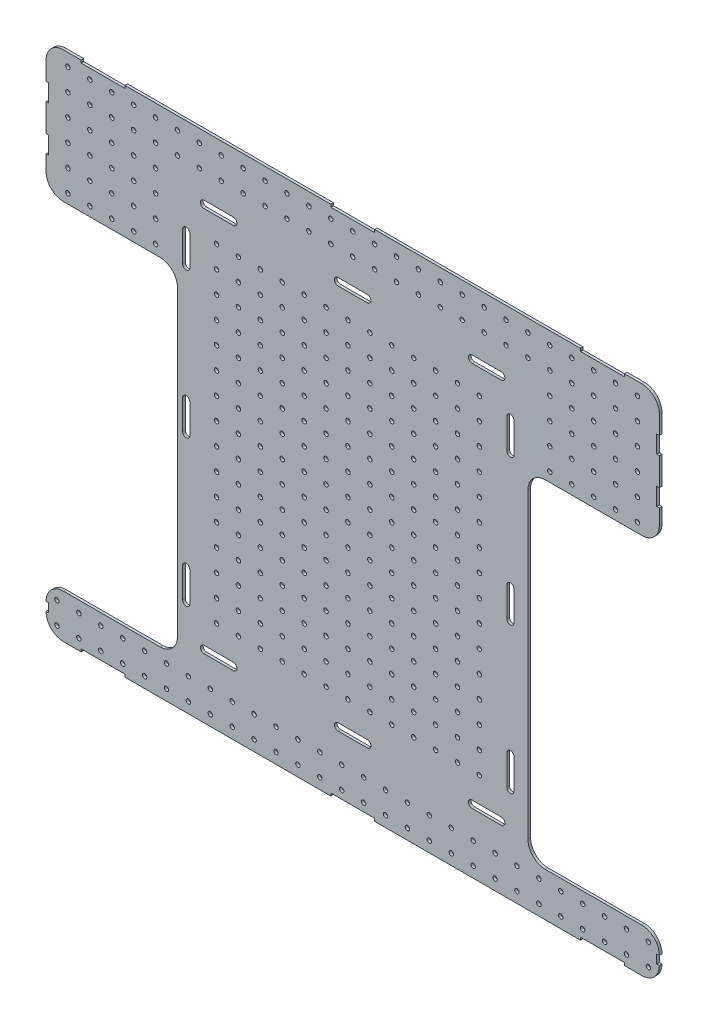
from build123d import *

# Parameters (mm, degrees)
SKETCH1_R           = 2
BOSS_EXTRUDE1_DEPTH = 3
CUT_EXTRUDE1_DEPTH  = 3
SKETCH3_W           = 50
SKETCH3_H           = 3
SKETCH3_W_2         = 3
SKETCH3_H_2         = 20
SKETCH3_H_3         = 10
CUT_EXTRUDE2_DEPTH  = 3
SKETCH4_W           = 321.794518566
SKETCH4_H           = 376.51592147
BOSS_EXTRUDE2_DEPTH = 3
SKETCH6_R           = 2.55
CUT_EXTRUDE4_DEPTH  = 3
SKETCH7_R           = 2.55
CUT_EXTRUDE5_DEPTH  = 3
SKETCH8_R           = 2.55
CUT_EXTRUDE6_DEPTH  = 3


with BuildPart() as part:
    # Sketch1 → Boss-Extrude1 (new body)
    with BuildSketch(Plane.XY):
        with BuildLine():
            ThreePointArc((-350, 162.5), (-344.142135624, 148.357864376), (-330, 142.5))
            Line((-330, 142.5), (-220, 142.5))
            ThreePointArc((-220, 142.5), (-205.857864376, 136.642135624), (-200, 122.5))
            Line((-200, 122.5), (-200, -222.5))
            ThreePointArc((-200, -222.5), (-205.857864376, -236.642135624), (-220, -242.5))
            Line((-220, -242.5), (-330, -242.5))
            ThreePointArc((-330, -242.5), (-344.142135624, -248.357864376), (-350, -262.5))
            Line((-350, -262.5), (-350, -272.5))
            ThreePointArc((-350, -272.5), (-344.142135624, -286.642135624), (-330, -292.5))
            Line((-330, -292.5), (330, -292.5))
            ThreePointArc((330, -292.5), (344.142135624, -286.642135624), (350, -272.5))
            Line((350, -272.5), (350, -262.5))
            ThreePointArc((350, -262.5), (344.142135624, -248.357864376), (330, -242.5))
            Line((330, -242.5), (220, -242.5))
            ThreePointArc((220, -242.5), (205.857864376, -236.642135624), (200, -222.5))
            Line((200, -222.5), (200, 122.5))
            ThreePointArc((200, 122.5), (205.857864376, 136.642135624), (220, 142.5))
            Line((220, 142.5), (330, 142.5))
            ThreePointArc((330, 142.5), (344.142135624, 148.357864376), (350, 162.5))
            Line((350, 162.5), (350, 272.5))
            ThreePointArc((350, 272.5), (344.142135624, 286.642135624), (330, 292.5))
            Line((330, 292.5), (-330, 292.5))
            ThreePointArc((-330, 292.5), (-344.142135624, 286.642135624), (-350, 272.5))
            Line((-350, 272.5), (-350, 162.5))
        make_face()
        with Locations((-155.454259852, -175.774310753)):
            Circle(SKETCH1_R, mode=Mode.SUBTRACT)
        with Locations((-125.454286004, -175.774310753)):
            Circle(SKETCH1_R, mode=Mode.SUBTRACT)
        with Locations((-95.454312157, -175.774310753)):
            Circle(SKETCH1_R, mode=Mode.SUBTRACT)
        with Locations((-65.454338309, -175.774310753)):
            Circle(SKETCH1_R, mode=Mode.SUBTRACT)
        with Locations((-35.454364461, -175.774310753)):
            Circle(SKETCH1_R, mode=Mode.SUBTRACT)
        with Locations((-5.454390613, -175.774310753)):
            Circle(SKETCH1_R, mode=Mode.SUBTRACT)
        with Locations((-155.412965879, -144.235849214)):
            Circle(SKETCH1_R, mode=Mode.SUBTRACT)
        with Locations((-155.371671907, -112.697387676)):
            Circle(SKETCH1_R, mode=Mode.SUBTRACT)
        with Locations((-125.412992032, -144.235849214)):
            Circle(SKETCH1_R, mode=Mode.SUBTRACT)
        with Locations((-95.413018184, -144.235849214)):
            Circle(SKETCH1_R, mode=Mode.SUBTRACT)
        with Locations((-125.371698059, -112.697387676)):
            Circle(SKETCH1_R, mode=Mode.SUBTRACT)
        with Locations((-95.371724211, -112.697387676)):
            Circle(SKETCH1_R, mode=Mode.SUBTRACT)
        with Locations((-155.330377934, -81.158926138)):
            Circle(SKETCH1_R, mode=Mode.SUBTRACT)
        with Locations((-125.330404086, -81.158926138)):
            Circle(SKETCH1_R, mode=Mode.SUBTRACT)
        with Locations((-95.330430238, -81.158926138)):
            Circle(SKETCH1_R, mode=Mode.SUBTRACT)
        with Locations((-65.413044336, -144.235849214)):
            Circle(SKETCH1_R, mode=Mode.SUBTRACT)
        with Locations((-65.371750363, -112.697387676)):
            Circle(SKETCH1_R, mode=Mode.SUBTRACT)
        with Locations((-35.413070488, -144.235849214)):
            Circle(SKETCH1_R, mode=Mode.SUBTRACT)
        with Locations((-5.41309664, -144.235849214)):
            Circle(SKETCH1_R, mode=Mode.SUBTRACT)
        with Locations((-35.371776515, -112.697387676)):
            Circle(SKETCH1_R, mode=Mode.SUBTRACT)
        with Locations((-5.371802668, -112.697387676)):
            Circle(SKETCH1_R, mode=Mode.SUBTRACT)
        with Locations((-65.330456391, -81.158926138)):
            Circle(SKETCH1_R, mode=Mode.SUBTRACT)
        with Locations((-35.330482543, -81.158926138)):
            Circle(SKETCH1_R, mode=Mode.SUBTRACT)
        with Locations((-5.330508695, -81.158926138)):
            Circle(SKETCH1_R, mode=Mode.SUBTRACT)
        with Locations((-155.289083961, -49.620464599)):
            Circle(SKETCH1_R, mode=Mode.SUBTRACT)
        with Locations((-125.289110113, -49.620464599)):
            Circle(SKETCH1_R, mode=Mode.SUBTRACT)
        with Locations((-95.289136266, -49.620464599)):
            Circle(SKETCH1_R, mode=Mode.SUBTRACT)
        with Locations((-155.247789989, -18.082003061)):
            Circle(SKETCH1_R, mode=Mode.SUBTRACT)
        with Locations((-125.247816141, -18.082003061)):
            Circle(SKETCH1_R, mode=Mode.SUBTRACT)
        with Locations((-95.247842293, -18.082003061)):
            Circle(SKETCH1_R, mode=Mode.SUBTRACT)
        with Locations((-65.289162418, -49.620464599)):
            Circle(SKETCH1_R, mode=Mode.SUBTRACT)
        with Locations((-35.28918857, -49.620464599)):
            Circle(SKETCH1_R, mode=Mode.SUBTRACT)
        with Locations((-5.289214722, -49.620464599)):
            Circle(SKETCH1_R, mode=Mode.SUBTRACT)
        with Locations((-65.247868445, -18.082003061)):
            Circle(SKETCH1_R, mode=Mode.SUBTRACT)
        with Locations((-35.247894597, -18.082003061)):
            Circle(SKETCH1_R, mode=Mode.SUBTRACT)
        with Locations((-5.24792075, -18.082003061)):
            Circle(SKETCH1_R, mode=Mode.SUBTRACT)
        with Locations((24.545583235, -175.774310753)):
            Circle(SKETCH1_R, mode=Mode.SUBTRACT)
        with Locations((54.545557082, -175.774310753)):
            Circle(SKETCH1_R, mode=Mode.SUBTRACT)
        with Locations((84.54553093, -175.774310753)):
            Circle(SKETCH1_R, mode=Mode.SUBTRACT)
        with Locations((114.545504778, -175.774310753)):
            Circle(SKETCH1_R, mode=Mode.SUBTRACT)
        with Locations((144.545478626, -175.774310753)):
            Circle(SKETCH1_R, mode=Mode.SUBTRACT)
        with Locations((24.586877207, -144.235849214)):
            Circle(SKETCH1_R, mode=Mode.SUBTRACT)
        with Locations((24.62817118, -112.697387676)):
            Circle(SKETCH1_R, mode=Mode.SUBTRACT)
        with Locations((54.586851055, -144.235849214)):
            Circle(SKETCH1_R, mode=Mode.SUBTRACT)
        with Locations((84.586824903, -144.235849214)):
            Circle(SKETCH1_R, mode=Mode.SUBTRACT)
        with Locations((54.628145028, -112.697387676)):
            Circle(SKETCH1_R, mode=Mode.SUBTRACT)
        with Locations((84.628118876, -112.697387676)):
            Circle(SKETCH1_R, mode=Mode.SUBTRACT)
        with Locations((24.669465153, -81.158926138)):
            Circle(SKETCH1_R, mode=Mode.SUBTRACT)
        with Locations((54.669439001, -81.158926138)):
            Circle(SKETCH1_R, mode=Mode.SUBTRACT)
        with Locations((84.669412848, -81.158926138)):
            Circle(SKETCH1_R, mode=Mode.SUBTRACT)
        with Locations((114.586798751, -144.235849214)):
            Circle(SKETCH1_R, mode=Mode.SUBTRACT)
        with Locations((114.628092723, -112.697387676)):
            Circle(SKETCH1_R, mode=Mode.SUBTRACT)
        with Locations((144.586772599, -144.235849214)):
            Circle(SKETCH1_R, mode=Mode.SUBTRACT)
        with Locations((144.628066571, -112.697387676)):
            Circle(SKETCH1_R, mode=Mode.SUBTRACT)
        with Locations((114.669386696, -81.158926138)):
            Circle(SKETCH1_R, mode=Mode.SUBTRACT)
        with Locations((144.669360544, -81.158926138)):
            Circle(SKETCH1_R, mode=Mode.SUBTRACT)
        with Locations((24.710759126, -49.620464599)):
            Circle(SKETCH1_R, mode=Mode.SUBTRACT)
        with Locations((54.710732973, -49.620464599)):
            Circle(SKETCH1_R, mode=Mode.SUBTRACT)
        with Locations((84.710706821, -49.620464599)):
            Circle(SKETCH1_R, mode=Mode.SUBTRACT)
        with Locations((18.577862564, -13.473496307)):
            Circle(SKETCH1_R, mode=Mode.SUBTRACT)
        with Locations((54.752026946, -18.082003061)):
            Circle(SKETCH1_R, mode=Mode.SUBTRACT)
        with Locations((84.752000794, -18.082003061)):
            Circle(SKETCH1_R, mode=Mode.SUBTRACT)
        with Locations((114.710680669, -49.620464599)):
            Circle(SKETCH1_R, mode=Mode.SUBTRACT)
        with Locations((144.710654517, -49.620464599)):
            Circle(SKETCH1_R, mode=Mode.SUBTRACT)
        with Locations((114.751974642, -18.082003061)):
            Circle(SKETCH1_R, mode=Mode.SUBTRACT)
        with Locations((144.751948489, -18.082003061)):
            Circle(SKETCH1_R, mode=Mode.SUBTRACT)
        with Locations((-155.206496016, 13.456458478)):
            Circle(SKETCH1_R, mode=Mode.SUBTRACT)
        with Locations((-125.206522168, 13.456458478)):
            Circle(SKETCH1_R, mode=Mode.SUBTRACT)
        with Locations((-95.20654832, 13.456458478)):
            Circle(SKETCH1_R, mode=Mode.SUBTRACT)
        with Locations((-155.165202043, 44.994920016)):
            Circle(SKETCH1_R, mode=Mode.SUBTRACT)
        with Locations((-125.165228195, 44.994920016)):
            Circle(SKETCH1_R, mode=Mode.SUBTRACT)
        with Locations((-95.165254347, 44.994920016)):
            Circle(SKETCH1_R, mode=Mode.SUBTRACT)
        with Locations((-65.206574472, 13.456458478)):
            Circle(SKETCH1_R, mode=Mode.SUBTRACT)
        with Locations((-35.206600625, 13.456458478)):
            Circle(SKETCH1_R, mode=Mode.SUBTRACT)
        with Locations((-5.206626777, 13.456458478)):
            Circle(SKETCH1_R, mode=Mode.SUBTRACT)
        with Locations((-65.1652805, 44.994920016)):
            Circle(SKETCH1_R, mode=Mode.SUBTRACT)
        with Locations((-35.165306652, 44.994920016)):
            Circle(SKETCH1_R, mode=Mode.SUBTRACT)
        with Locations((-5.165332804, 44.994920016)):
            Circle(SKETCH1_R, mode=Mode.SUBTRACT)
        with Locations((-155.12390807, 76.533381555)):
            Circle(SKETCH1_R, mode=Mode.SUBTRACT)
        with Locations((-125.123934223, 76.533381555)):
            Circle(SKETCH1_R, mode=Mode.SUBTRACT)
        with Locations((-99.978657018, 82.790106768)):
            Circle(SKETCH1_R, mode=Mode.SUBTRACT)
        with Locations((-95.082666402, 108.071843093)):
            Circle(SKETCH1_R, mode=Mode.SUBTRACT)
        with Locations((-65.123986527, 76.533381555)):
            Circle(SKETCH1_R, mode=Mode.SUBTRACT)
        with Locations((-65.082692554, 108.071843093)):
            Circle(SKETCH1_R, mode=Mode.SUBTRACT)
        with Locations((-35.124012679, 76.533381555)):
            Circle(SKETCH1_R, mode=Mode.SUBTRACT)
        with Locations((-5.124038831, 76.533381555)):
            Circle(SKETCH1_R, mode=Mode.SUBTRACT)
        with Locations((-35.082718706, 108.071843093)):
            Circle(SKETCH1_R, mode=Mode.SUBTRACT)
        with Locations((-5.082744859, 108.071843093)):
            Circle(SKETCH1_R, mode=Mode.SUBTRACT)
        with Locations((-65.041398582, 139.610304632)):
            Circle(SKETCH1_R, mode=Mode.SUBTRACT)
        with Locations((-35.041424734, 139.610304632)):
            Circle(SKETCH1_R, mode=Mode.SUBTRACT)
        with Locations((-5.041450886, 139.610304632)):
            Circle(SKETCH1_R, mode=Mode.SUBTRACT)
        with Locations((24.793347071, 13.456458478)):
            Circle(SKETCH1_R, mode=Mode.SUBTRACT)
        with Locations((54.793320919, 13.456458478)):
            Circle(SKETCH1_R, mode=Mode.SUBTRACT)
        with Locations((84.793294767, 13.456458478)):
            Circle(SKETCH1_R, mode=Mode.SUBTRACT)
        with Locations((24.834641044, 44.994920016)):
            Circle(SKETCH1_R, mode=Mode.SUBTRACT)
        with Locations((54.834614891, 44.994920016)):
            Circle(SKETCH1_R, mode=Mode.SUBTRACT)
        with Locations((84.834588739, 44.994920016)):
            Circle(SKETCH1_R, mode=Mode.SUBTRACT)
        with Locations((114.793268614, 13.456458478)):
            Circle(SKETCH1_R, mode=Mode.SUBTRACT)
        with Locations((144.793242462, 13.456458478)):
            Circle(SKETCH1_R, mode=Mode.SUBTRACT)
        with Locations((114.834562587, 44.994920016)):
            Circle(SKETCH1_R, mode=Mode.SUBTRACT)
        with Locations((144.834536435, 44.994920016)):
            Circle(SKETCH1_R, mode=Mode.SUBTRACT)
        with Locations((24.875935016, 76.533381555)):
            Circle(SKETCH1_R, mode=Mode.SUBTRACT)
        with Locations((24.917228989, 108.071843093)):
            Circle(SKETCH1_R, mode=Mode.SUBTRACT)
        with Locations((54.875908864, 76.533381555)):
            Circle(SKETCH1_R, mode=Mode.SUBTRACT)
        with Locations((84.875882712, 76.533381555)):
            Circle(SKETCH1_R, mode=Mode.SUBTRACT)
        with Locations((54.917202837, 108.071843093)):
            Circle(SKETCH1_R, mode=Mode.SUBTRACT)
        with Locations((84.917176685, 108.071843093)):
            Circle(SKETCH1_R, mode=Mode.SUBTRACT)
        with Locations((24.958522962, 139.610304632)):
            Circle(SKETCH1_R, mode=Mode.SUBTRACT)
        with Locations((54.95849681, 139.610304632)):
            Circle(SKETCH1_R, mode=Mode.SUBTRACT)
        with Locations((84.958470657, 139.610304632)):
            Circle(SKETCH1_R, mode=Mode.SUBTRACT)
        with Locations((114.87585656, 76.533381555)):
            Circle(SKETCH1_R, mode=Mode.SUBTRACT)
        with Locations((114.917150533, 108.071843093)):
            Circle(SKETCH1_R, mode=Mode.SUBTRACT)
        with Locations((144.875830408, 76.533381555)):
            Circle(SKETCH1_R, mode=Mode.SUBTRACT)
        with Locations((144.91712438, 108.071843093)):
            Circle(SKETCH1_R, mode=Mode.SUBTRACT)
        with Locations((114.958444505, 139.610304632)):
            Circle(SKETCH1_R, mode=Mode.SUBTRACT)
        with Locations((144.958418353, 139.610304632)):
            Circle(SKETCH1_R, mode=Mode.SUBTRACT)
    extrude(amount=BOSS_EXTRUDE1_DEPTH)

    # Sketch2 → Cut-Extrude1 (cut)
    with BuildSketch(Plane.XY.offset(3)):
        with BuildLine():
            ThreePointArc((-169.641960394, 224.1), (-173.741960394, 220), (-169.641960394, 215.9))
            Line((-169.641960394, 215.9), (-136.209126648, 215.9))
            ThreePointArc((-136.209126648, 215.9), (-132.109126648, 220), (-136.209126648, 224.1))
            Line((-136.209126648, 224.1), (-169.641960394, 224.1))
        make_face()
        with BuildLine():
            ThreePointArc((-169.641960394, -215.9), (-173.741960394, -220), (-169.641960394, -224.1))
            Line((-169.641960394, -224.1), (-136.209126648, -224.1))
            ThreePointArc((-136.209126648, -224.1), (-132.109126648, -220), (-136.209126648, -215.9))
            Line((-136.209126648, -215.9), (-169.641960394, -215.9))
        make_face()
        with BuildLine():
            ThreePointArc((169.641960394, 215.9), (173.741960394, 220), (169.641960394, 224.1))
            Line((169.641960394, 224.1), (136.209126648, 224.1))
            ThreePointArc((136.209126648, 224.1), (132.109126648, 220), (136.209126648, 215.9))
            Line((136.209126648, 215.9), (169.641960394, 215.9))
        make_face()
        with BuildLine():
            ThreePointArc((-16.715, 224.1), (-20.815, 220), (-16.715, 215.9))
            Line((-16.715, 215.9), (16.715, 215.9))
            ThreePointArc((16.715, 215.9), (20.815, 220), (16.715, 224.1))
            Line((16.715, 224.1), (-16.715, 224.1))
        make_face()
        with BuildLine():
            ThreePointArc((169.641960394, -224.1), (173.741960394, -220), (169.641960394, -215.9))
            Line((169.641960394, -215.9), (136.209126648, -215.9))
            ThreePointArc((136.209126648, -215.9), (132.109126648, -220), (136.209126648, -224.1))
            Line((136.209126648, -224.1), (169.641960394, -224.1))
        make_face()
        with BuildLine():
            ThreePointArc((-16.715, -215.9), (-20.815, -220), (-16.715, -224.1))
            Line((-16.715, -224.1), (16.715, -224.1))
            ThreePointArc((16.715, -224.1), (20.815, -220), (16.715, -215.9))
            Line((16.715, -215.9), (-16.715, -215.9))
        make_face()
        with BuildLine():
            ThreePointArc((-185.9, 183.295797128), (-190, 187.395797128), (-194.1, 183.295797128))
            Line((-194.1, 183.295797128), (-194.1, 149.131010897))
            ThreePointArc((-194.1, 149.131010897), (-190, 145.031010897), (-185.9, 149.131010897))
            Line((-185.9, 149.131010897), (-185.9, 183.295797128))
        make_face()
        with BuildLine():
            ThreePointArc((184.1, 183.295797128), (180, 187.395797128), (175.9, 183.295797128))
            Line((175.9, 183.295797128), (175.9, 149.131010897))
            ThreePointArc((175.9, 149.131010897), (180, 145.031010897), (184.1, 149.131010897))
            Line((184.1, 149.131010897), (184.1, 183.295797128))
        make_face()
        with BuildLine():
            ThreePointArc((-194.1, -183.295797128), (-190, -187.395797128), (-185.9, -183.295797128))
            Line((-185.9, -183.295797128), (-185.9, -149.131010897))
            ThreePointArc((-185.9, -149.131010897), (-190, -145.031010897), (-194.1, -149.131010897))
            Line((-194.1, -149.131010897), (-194.1, -183.295797128))
        make_face()
        with BuildLine():
            Line((175.9, -149.131010897), (175.9, -183.295797128))
            ThreePointArc((175.9, -183.295797128), (180, -187.395797128), (184.1, -183.295797128))
            Line((184.1, -183.295797128), (184.1, -149.131010897))
            ThreePointArc((184.1, -149.131010897), (180, -145.031010897), (175.9, -149.131010897))
        make_face()
        with BuildLine():
            Line((184.1, -16.715), (184.1, 16.715))
            ThreePointArc((184.1, 16.715), (180, 20.815), (175.9, 16.715))
            Line((175.9, 16.715), (175.9, -16.715))
            ThreePointArc((175.9, -16.715), (180, -20.815), (184.1, -16.715))
        make_face()
        with BuildLine():
            ThreePointArc((-185.9, 16.715), (-190, 20.815), (-194.1, 16.715))
            Line((-194.1, 16.715), (-194.1, -16.715))
            ThreePointArc((-194.1, -16.715), (-190, -20.815), (-185.9, -16.715))
            Line((-185.9, -16.715), (-185.9, 16.715))
        make_face()
    extrude(amount=-CUT_EXTRUDE1_DEPTH, mode=Mode.SUBTRACT)

    # Sketch3 → Cut-Extrude2 (cut)
    with BuildSketch(Plane.XY.offset(3)):
        with Locations((-285, 291)):
            Rectangle(SKETCH3_W, SKETCH3_H)
        with Locations((0, 291)):
            Rectangle(SKETCH3_W, SKETCH3_H)
        with Locations((285, 291)):
            Rectangle(SKETCH3_W, SKETCH3_H)
        with Locations((-348.5, 241.362705002)):
            Rectangle(SKETCH3_W_2, SKETCH3_H_2)
        with Locations((348.5, 241.362705002)):
            Rectangle(SKETCH3_W_2, SKETCH3_H_2)
        with Locations((285, -291)):
            Rectangle(SKETCH3_W, SKETCH3_H)
        with Locations((0, -291)):
            Rectangle(SKETCH3_W, SKETCH3_H)
        with Locations((-285, -291)):
            Rectangle(SKETCH3_W, SKETCH3_H)
        with Locations((348.5, 189.79436506)):
            Rectangle(SKETCH3_W_2, SKETCH3_H_2)
        with Locations((-348.5, -267.5)):
            Rectangle(SKETCH3_W_2, SKETCH3_H_3)
        with Locations((348.5, -267.5)):
            Rectangle(SKETCH3_W_2, SKETCH3_H_3)
        with Locations((-348.5, 189.79436506)):
            Rectangle(SKETCH3_W_2, SKETCH3_H_2)
    extrude(amount=-CUT_EXTRUDE2_DEPTH, mode=Mode.SUBTRACT)

    # Sketch4 → Boss-Extrude2 (add)
    with BuildSketch(Plane.XY.offset(3)):
        Rectangle(SKETCH4_W, SKETCH4_H)
    extrude(amount=-BOSS_EXTRUDE2_DEPTH)

    # Sketch6 → Cut-Extrude4 (cut)
    with BuildSketch(Plane.XY.offset(3)):
        with Locations((-325, 278.197372389)):
            Circle(SKETCH6_R)
        with Locations((-300, 278.197372389)):
            Circle(SKETCH6_R)
        with Locations((-275, 278.197372389)):
            Circle(SKETCH6_R)
        with Locations((-250, 278.197372389)):
            Circle(SKETCH6_R)
        with Locations((-225, 278.197372389)):
            Circle(SKETCH6_R)
        with Locations((-200, 278.197372389)):
            Circle(SKETCH6_R)
        with Locations((-175, 278.197372389)):
            Circle(SKETCH6_R)
        with Locations((-150, 278.197372389)):
            Circle(SKETCH6_R)
        with Locations((-125, 278.197372389)):
            Circle(SKETCH6_R)
        with Locations((-100, 278.197372389)):
            Circle(SKETCH6_R)
        with Locations((-75, 278.197372389)):
            Circle(SKETCH6_R)
        with Locations((-50, 278.197372389)):
            Circle(SKETCH6_R)
        with Locations((-25, 278.197372389)):
            Circle(SKETCH6_R)
        with Locations((0, 278.197372389)):
            Circle(SKETCH6_R)
        with Locations((25, 278.197372389)):
            Circle(SKETCH6_R)
        with Locations((50, 278.197372389)):
            Circle(SKETCH6_R)
        with Locations((75, 278.197372389)):
            Circle(SKETCH6_R)
        with Locations((100, 278.197372389)):
            Circle(SKETCH6_R)
        with Locations((125, 278.197372389)):
            Circle(SKETCH6_R)
        with Locations((150, 278.197372389)):
            Circle(SKETCH6_R)
        with Locations((175, 278.197372389)):
            Circle(SKETCH6_R)
        with Locations((200, 278.197372389)):
            Circle(SKETCH6_R)
        with Locations((225, 278.197372389)):
            Circle(SKETCH6_R)
        with Locations((250, 278.197372389)):
            Circle(SKETCH6_R)
        with Locations((275, 278.197372389)):
            Circle(SKETCH6_R)
        with Locations((300, 278.197372389)):
            Circle(SKETCH6_R)
        with Locations((325, 278.197372389)):
            Circle(SKETCH6_R)
        with Locations((-300, 253.197372389)):
            Circle(SKETCH6_R)
        with Locations((-275, 253.197372389)):
            Circle(SKETCH6_R)
        with Locations((-250, 253.197372389)):
            Circle(SKETCH6_R)
        with Locations((-225, 253.197372389)):
            Circle(SKETCH6_R)
        with Locations((-200, 253.197372389)):
            Circle(SKETCH6_R)
        with Locations((-175, 253.197372389)):
            Circle(SKETCH6_R)
        with Locations((-150, 253.197372389)):
            Circle(SKETCH6_R)
        with Locations((-125, 253.197372389)):
            Circle(SKETCH6_R)
        with Locations((-100, 253.197372389)):
            Circle(SKETCH6_R)
        with Locations((-75, 253.197372389)):
            Circle(SKETCH6_R)
        with Locations((-50, 253.197372389)):
            Circle(SKETCH6_R)
        with Locations((-25, 253.197372389)):
            Circle(SKETCH6_R)
        with Locations((0, 253.197372389)):
            Circle(SKETCH6_R)
        with Locations((25, 253.197372389)):
            Circle(SKETCH6_R)
        with Locations((50, 253.197372389)):
            Circle(SKETCH6_R)
        with Locations((75, 253.197372389)):
            Circle(SKETCH6_R)
        with Locations((100, 253.197372389)):
            Circle(SKETCH6_R)
        with Locations((125, 253.197372389)):
            Circle(SKETCH6_R)
        with Locations((150, 253.197372389)):
            Circle(SKETCH6_R)
        with Locations((175, 253.197372389)):
            Circle(SKETCH6_R)
        with Locations((200, 253.197372389)):
            Circle(SKETCH6_R)
        with Locations((225, 253.197372389)):
            Circle(SKETCH6_R)
        with Locations((250, 253.197372389)):
            Circle(SKETCH6_R)
        with Locations((275, 253.197372389)):
            Circle(SKETCH6_R)
        with Locations((300, 253.197372389)):
            Circle(SKETCH6_R)
        with Locations((325, 253.197372389)):
            Circle(SKETCH6_R)
        with Locations((-325, 253.197372389)):
            Circle(SKETCH6_R)
        with Locations((-325, 228.197372389)):
            Circle(SKETCH6_R)
        with Locations((-300, 228.197372389)):
            Circle(SKETCH6_R)
        with Locations((-275, 228.197372389)):
            Circle(SKETCH6_R)
        with Locations((-250, 228.197372389)):
            Circle(SKETCH6_R)
        with Locations((-225, 228.197372389)):
            Circle(SKETCH6_R)
        with Locations((-325, 203.197372389)):
            Circle(SKETCH6_R)
        with Locations((-300, 203.197372389)):
            Circle(SKETCH6_R)
        with Locations((-275, 203.197372389)):
            Circle(SKETCH6_R)
        with Locations((-250, 203.197372389)):
            Circle(SKETCH6_R)
        with Locations((-225, 203.197372389)):
            Circle(SKETCH6_R)
        with Locations((-325, 178.197372389)):
            Circle(SKETCH6_R)
        with Locations((-300, 178.197372389)):
            Circle(SKETCH6_R)
        with Locations((-275, 178.197372389)):
            Circle(SKETCH6_R)
        with Locations((-250, 178.197372389)):
            Circle(SKETCH6_R)
        with Locations((-225, 178.197372389)):
            Circle(SKETCH6_R)
        with Locations((-325, 153.197372389)):
            Circle(SKETCH6_R)
        with Locations((-300, 153.197372389)):
            Circle(SKETCH6_R)
        with Locations((-275, 153.197372389)):
            Circle(SKETCH6_R)
        with Locations((-250, 153.197372389)):
            Circle(SKETCH6_R)
        with Locations((-225, 153.197372389)):
            Circle(SKETCH6_R)
        with Locations((225, 228.197372389)):
            Circle(SKETCH6_R)
        with Locations((250, 228.197372389)):
            Circle(SKETCH6_R)
        with Locations((275, 228.197372389)):
            Circle(SKETCH6_R)
        with Locations((300, 228.197372389)):
            Circle(SKETCH6_R)
        with Locations((325, 228.197372389)):
            Circle(SKETCH6_R)
        with Locations((225, 203.197372389)):
            Circle(SKETCH6_R)
        with Locations((250, 203.197372389)):
            Circle(SKETCH6_R)
        with Locations((275, 203.197372389)):
            Circle(SKETCH6_R)
        with Locations((300, 203.197372389)):
            Circle(SKETCH6_R)
        with Locations((325, 203.197372389)):
            Circle(SKETCH6_R)
        with Locations((225, 178.197372389)):
            Circle(SKETCH6_R)
        with Locations((250, 178.197372389)):
            Circle(SKETCH6_R)
        with Locations((275, 178.197372389)):
            Circle(SKETCH6_R)
        with Locations((300, 178.197372389)):
            Circle(SKETCH6_R)
        with Locations((325, 178.197372389)):
            Circle(SKETCH6_R)
        with Locations((225, 153.197372389)):
            Circle(SKETCH6_R)
        with Locations((250, 153.197372389)):
            Circle(SKETCH6_R)
        with Locations((275, 153.197372389)):
            Circle(SKETCH6_R)
        with Locations((300, 153.197372389)):
            Circle(SKETCH6_R)
        with Locations((325, 153.197372389)):
            Circle(SKETCH6_R)
    extrude(amount=-CUT_EXTRUDE4_DEPTH, mode=Mode.SUBTRACT)

    # Sketch7 → Cut-Extrude5 (cut)
    with BuildSketch(Plane.XY.offset(3)):
        with Locations((-337.515866972, -255.273043985)):
            Circle(SKETCH7_R)
        with Locations((-312.515866972, -255.273043985)):
            Circle(SKETCH7_R)
        with Locations((-287.515866972, -255.273043985)):
            Circle(SKETCH7_R)
        with Locations((-262.515866972, -255.273043985)):
            Circle(SKETCH7_R)
        with Locations((-237.515866972, -255.273043985)):
            Circle(SKETCH7_R)
        with Locations((-212.515866972, -255.273043985)):
            Circle(SKETCH7_R)
        with Locations((-187.515866972, -255.273043985)):
            Circle(SKETCH7_R)
        with Locations((-162.515866972, -255.273043985)):
            Circle(SKETCH7_R)
        with Locations((-137.515866972, -255.273043985)):
            Circle(SKETCH7_R)
        with Locations((-112.515866972, -255.273043985)):
            Circle(SKETCH7_R)
        with Locations((-87.515866972, -255.273043985)):
            Circle(SKETCH7_R)
        with Locations((-62.515866972, -255.273043985)):
            Circle(SKETCH7_R)
        with Locations((-37.515866972, -255.273043985)):
            Circle(SKETCH7_R)
        with Locations((-12.515866972, -255.273043985)):
            Circle(SKETCH7_R)
        with Locations((12.484133028, -255.273043985)):
            Circle(SKETCH7_R)
        with Locations((37.484133028, -255.273043985)):
            Circle(SKETCH7_R)
        with Locations((62.484133028, -255.273043985)):
            Circle(SKETCH7_R)
        with Locations((87.484133028, -255.273043985)):
            Circle(SKETCH7_R)
        with Locations((112.484133028, -255.273043985)):
            Circle(SKETCH7_R)
        with Locations((137.484133028, -255.273043985)):
            Circle(SKETCH7_R)
        with Locations((162.484133028, -255.273043985)):
            Circle(SKETCH7_R)
        with Locations((187.484133028, -255.273043985)):
            Circle(SKETCH7_R)
        with Locations((212.484133028, -255.273043985)):
            Circle(SKETCH7_R)
        with Locations((237.484133028, -255.273043985)):
            Circle(SKETCH7_R)
        with Locations((262.484133028, -255.273043985)):
            Circle(SKETCH7_R)
        with Locations((287.484133028, -255.273043985)):
            Circle(SKETCH7_R)
        with Locations((312.484133028, -255.273043985)):
            Circle(SKETCH7_R)
        with Locations((337.484133028, -255.273043985)):
            Circle(SKETCH7_R)
        with Locations((-312.515866972, -280.273043985)):
            Circle(SKETCH7_R)
        with Locations((-287.515866972, -280.273043985)):
            Circle(SKETCH7_R)
        with Locations((-262.515866972, -280.273043985)):
            Circle(SKETCH7_R)
        with Locations((-237.515866972, -280.273043985)):
            Circle(SKETCH7_R)
        with Locations((-212.515866972, -280.273043985)):
            Circle(SKETCH7_R)
        with Locations((-187.515866972, -280.273043985)):
            Circle(SKETCH7_R)
        with Locations((-162.515866972, -280.273043985)):
            Circle(SKETCH7_R)
        with Locations((-137.515866972, -280.273043985)):
            Circle(SKETCH7_R)
        with Locations((-112.515866972, -280.273043985)):
            Circle(SKETCH7_R)
        with Locations((-87.515866972, -280.273043985)):
            Circle(SKETCH7_R)
        with Locations((-62.515866972, -280.273043985)):
            Circle(SKETCH7_R)
        with Locations((-37.515866972, -280.273043985)):
            Circle(SKETCH7_R)
        with Locations((-12.515866972, -280.273043985)):
            Circle(SKETCH7_R)
        with Locations((12.484133028, -280.273043985)):
            Circle(SKETCH7_R)
        with Locations((37.484133028, -280.273043985)):
            Circle(SKETCH7_R)
        with Locations((62.484133028, -280.273043985)):
            Circle(SKETCH7_R)
        with Locations((87.484133028, -280.273043985)):
            Circle(SKETCH7_R)
        with Locations((112.484133028, -280.273043985)):
            Circle(SKETCH7_R)
        with Locations((137.484133028, -280.273043985)):
            Circle(SKETCH7_R)
        with Locations((162.484133028, -280.273043985)):
            Circle(SKETCH7_R)
        with Locations((187.484133028, -280.273043985)):
            Circle(SKETCH7_R)
        with Locations((212.484133028, -280.273043985)):
            Circle(SKETCH7_R)
        with Locations((237.484133028, -280.273043985)):
            Circle(SKETCH7_R)
        with Locations((262.484133028, -280.273043985)):
            Circle(SKETCH7_R)
        with Locations((287.484133028, -280.273043985)):
            Circle(SKETCH7_R)
        with Locations((312.484133028, -280.273043985)):
            Circle(SKETCH7_R)
        with Locations((337.484133028, -280.273043985)):
            Circle(SKETCH7_R)
        with Locations((-337.515866972, -280.273043985)):
            Circle(SKETCH7_R)
    extrude(amount=-CUT_EXTRUDE5_DEPTH, mode=Mode.SUBTRACT)

    # Sketch8 → Cut-Extrude6 (cut)
    with BuildSketch(Plane.XY.offset(3)):
        with Locations((-155.4, 187.9)):
            Circle(SKETCH8_R)
        with Locations((-130.4, 187.9)):
            Circle(SKETCH8_R)
        with Locations((-105.4, 187.9)):
            Circle(SKETCH8_R)
        with Locations((-80.4, 187.9)):
            Circle(SKETCH8_R)
        with Locations((-55.4, 187.9)):
            Circle(SKETCH8_R)
        with Locations((-30.4, 187.9)):
            Circle(SKETCH8_R)
        with Locations((-5.4, 187.9)):
            Circle(SKETCH8_R)
        with Locations((19.6, 187.9)):
            Circle(SKETCH8_R)
        with Locations((44.6, 187.9)):
            Circle(SKETCH8_R)
        with Locations((69.6, 187.9)):
            Circle(SKETCH8_R)
        with Locations((94.6, 187.9)):
            Circle(SKETCH8_R)
        with Locations((119.6, 187.9)):
            Circle(SKETCH8_R)
        with Locations((144.6, 187.9)):
            Circle(SKETCH8_R)
        with Locations((-130.4, 162.9)):
            Circle(SKETCH8_R)
        with Locations((-105.4, 162.9)):
            Circle(SKETCH8_R)
        with Locations((-80.4, 162.9)):
            Circle(SKETCH8_R)
        with Locations((-55.4, 162.9)):
            Circle(SKETCH8_R)
        with Locations((-30.4, 162.9)):
            Circle(SKETCH8_R)
        with Locations((-5.4, 162.9)):
            Circle(SKETCH8_R)
        with Locations((19.6, 162.9)):
            Circle(SKETCH8_R)
        with Locations((44.6, 162.9)):
            Circle(SKETCH8_R)
        with Locations((69.6, 162.9)):
            Circle(SKETCH8_R)
        with Locations((94.6, 162.9)):
            Circle(SKETCH8_R)
        with Locations((119.6, 162.9)):
            Circle(SKETCH8_R)
        with Locations((144.6, 162.9)):
            Circle(SKETCH8_R)
        with Locations((-130.4, 137.9)):
            Circle(SKETCH8_R)
        with Locations((-105.4, 137.9)):
            Circle(SKETCH8_R)
        with Locations((-80.4, 137.9)):
            Circle(SKETCH8_R)
        with Locations((-55.4, 137.9)):
            Circle(SKETCH8_R)
        with Locations((-30.4, 137.9)):
            Circle(SKETCH8_R)
        with Locations((-5.4, 137.9)):
            Circle(SKETCH8_R)
        with Locations((19.6, 137.9)):
            Circle(SKETCH8_R)
        with Locations((44.6, 137.9)):
            Circle(SKETCH8_R)
        with Locations((69.6, 137.9)):
            Circle(SKETCH8_R)
        with Locations((94.6, 137.9)):
            Circle(SKETCH8_R)
        with Locations((119.6, 137.9)):
            Circle(SKETCH8_R)
        with Locations((144.6, 137.9)):
            Circle(SKETCH8_R)
        with Locations((-130.4, 112.9)):
            Circle(SKETCH8_R)
        with Locations((-105.4, 112.9)):
            Circle(SKETCH8_R)
        with Locations((-80.4, 112.9)):
            Circle(SKETCH8_R)
        with Locations((-55.4, 112.9)):
            Circle(SKETCH8_R)
        with Locations((-30.4, 112.9)):
            Circle(SKETCH8_R)
        with Locations((-5.4, 112.9)):
            Circle(SKETCH8_R)
        with Locations((19.6, 112.9)):
            Circle(SKETCH8_R)
        with Locations((44.6, 112.9)):
            Circle(SKETCH8_R)
        with Locations((69.6, 112.9)):
            Circle(SKETCH8_R)
        with Locations((94.6, 112.9)):
            Circle(SKETCH8_R)
        with Locations((119.6, 112.9)):
            Circle(SKETCH8_R)
        with Locations((144.6, 112.9)):
            Circle(SKETCH8_R)
        with Locations((-130.4, 87.9)):
            Circle(SKETCH8_R)
        with Locations((-105.4, 87.9)):
            Circle(SKETCH8_R)
        with Locations((-80.4, 87.9)):
            Circle(SKETCH8_R)
        with Locations((-55.4, 87.9)):
            Circle(SKETCH8_R)
        with Locations((-30.4, 87.9)):
            Circle(SKETCH8_R)
        with Locations((-5.4, 87.9)):
            Circle(SKETCH8_R)
        with Locations((19.6, 87.9)):
            Circle(SKETCH8_R)
        with Locations((44.6, 87.9)):
            Circle(SKETCH8_R)
        with Locations((69.6, 87.9)):
            Circle(SKETCH8_R)
        with Locations((94.6, 87.9)):
            Circle(SKETCH8_R)
        with Locations((119.6, 87.9)):
            Circle(SKETCH8_R)
        with Locations((144.6, 87.9)):
            Circle(SKETCH8_R)
        with Locations((-130.4, 62.9)):
            Circle(SKETCH8_R)
        with Locations((-105.4, 62.9)):
            Circle(SKETCH8_R)
        with Locations((-80.4, 62.9)):
            Circle(SKETCH8_R)
        with Locations((-55.4, 62.9)):
            Circle(SKETCH8_R)
        with Locations((-30.4, 62.9)):
            Circle(SKETCH8_R)
        with Locations((-5.4, 62.9)):
            Circle(SKETCH8_R)
        with Locations((19.6, 62.9)):
            Circle(SKETCH8_R)
        with Locations((44.6, 62.9)):
            Circle(SKETCH8_R)
        with Locations((69.6, 62.9)):
            Circle(SKETCH8_R)
        with Locations((94.6, 62.9)):
            Circle(SKETCH8_R)
        with Locations((119.6, 62.9)):
            Circle(SKETCH8_R)
        with Locations((144.6, 62.9)):
            Circle(SKETCH8_R)
        with Locations((-130.4, 37.9)):
            Circle(SKETCH8_R)
        with Locations((-105.4, 37.9)):
            Circle(SKETCH8_R)
        with Locations((-80.4, 37.9)):
            Circle(SKETCH8_R)
        with Locations((-55.4, 37.9)):
            Circle(SKETCH8_R)
        with Locations((-30.4, 37.9)):
            Circle(SKETCH8_R)
        with Locations((-5.4, 37.9)):
            Circle(SKETCH8_R)
        with Locations((19.6, 37.9)):
            Circle(SKETCH8_R)
        with Locations((44.6, 37.9)):
            Circle(SKETCH8_R)
        with Locations((69.6, 37.9)):
            Circle(SKETCH8_R)
        with Locations((94.6, 37.9)):
            Circle(SKETCH8_R)
        with Locations((119.6, 37.9)):
            Circle(SKETCH8_R)
        with Locations((144.6, 37.9)):
            Circle(SKETCH8_R)
        with Locations((-130.4, 12.9)):
            Circle(SKETCH8_R)
        with Locations((-105.4, 12.9)):
            Circle(SKETCH8_R)
        with Locations((-80.4, 12.9)):
            Circle(SKETCH8_R)
        with Locations((-55.4, 12.9)):
            Circle(SKETCH8_R)
        with Locations((-30.4, 12.9)):
            Circle(SKETCH8_R)
        with Locations((-5.4, 12.9)):
            Circle(SKETCH8_R)
        with Locations((19.6, 12.9)):
            Circle(SKETCH8_R)
        with Locations((44.6, 12.9)):
            Circle(SKETCH8_R)
        with Locations((69.6, 12.9)):
            Circle(SKETCH8_R)
        with Locations((94.6, 12.9)):
            Circle(SKETCH8_R)
        with Locations((119.6, 12.9)):
            Circle(SKETCH8_R)
        with Locations((144.6, 12.9)):
            Circle(SKETCH8_R)
        with Locations((-130.4, -12.1)):
            Circle(SKETCH8_R)
        with Locations((-105.4, -12.1)):
            Circle(SKETCH8_R)
        with Locations((-80.4, -12.1)):
            Circle(SKETCH8_R)
        with Locations((-55.4, -12.1)):
            Circle(SKETCH8_R)
        with Locations((-30.4, -12.1)):
            Circle(SKETCH8_R)
        with Locations((-5.4, -12.1)):
            Circle(SKETCH8_R)
        with Locations((19.6, -12.1)):
            Circle(SKETCH8_R)
        with Locations((44.6, -12.1)):
            Circle(SKETCH8_R)
        with Locations((69.6, -12.1)):
            Circle(SKETCH8_R)
        with Locations((94.6, -12.1)):
            Circle(SKETCH8_R)
        with Locations((119.6, -12.1)):
            Circle(SKETCH8_R)
        with Locations((144.6, -12.1)):
            Circle(SKETCH8_R)
        with Locations((-130.4, -37.1)):
            Circle(SKETCH8_R)
        with Locations((-105.4, -37.1)):
            Circle(SKETCH8_R)
        with Locations((-80.4, -37.1)):
            Circle(SKETCH8_R)
        with Locations((-55.4, -37.1)):
            Circle(SKETCH8_R)
        with Locations((-30.4, -37.1)):
            Circle(SKETCH8_R)
        with Locations((-5.4, -37.1)):
            Circle(SKETCH8_R)
        with Locations((19.6, -37.1)):
            Circle(SKETCH8_R)
        with Locations((44.6, -37.1)):
            Circle(SKETCH8_R)
        with Locations((69.6, -37.1)):
            Circle(SKETCH8_R)
        with Locations((94.6, -37.1)):
            Circle(SKETCH8_R)
        with Locations((119.6, -37.1)):
            Circle(SKETCH8_R)
        with Locations((144.6, -37.1)):
            Circle(SKETCH8_R)
        with Locations((-130.4, -62.1)):
            Circle(SKETCH8_R)
        with Locations((-105.4, -62.1)):
            Circle(SKETCH8_R)
        with Locations((-80.4, -62.1)):
            Circle(SKETCH8_R)
        with Locations((-55.4, -62.1)):
            Circle(SKETCH8_R)
        with Locations((-30.4, -62.1)):
            Circle(SKETCH8_R)
        with Locations((-5.4, -62.1)):
            Circle(SKETCH8_R)
        with Locations((19.6, -62.1)):
            Circle(SKETCH8_R)
        with Locations((44.6, -62.1)):
            Circle(SKETCH8_R)
        with Locations((69.6, -62.1)):
            Circle(SKETCH8_R)
        with Locations((94.6, -62.1)):
            Circle(SKETCH8_R)
        with Locations((119.6, -62.1)):
            Circle(SKETCH8_R)
        with Locations((144.6, -62.1)):
            Circle(SKETCH8_R)
        with Locations((-130.4, -87.1)):
            Circle(SKETCH8_R)
        with Locations((-105.4, -87.1)):
            Circle(SKETCH8_R)
        with Locations((-80.4, -87.1)):
            Circle(SKETCH8_R)
        with Locations((-55.4, -87.1)):
            Circle(SKETCH8_R)
        with Locations((-30.4, -87.1)):
            Circle(SKETCH8_R)
        with Locations((-5.4, -87.1)):
            Circle(SKETCH8_R)
        with Locations((19.6, -87.1)):
            Circle(SKETCH8_R)
        with Locations((44.6, -87.1)):
            Circle(SKETCH8_R)
        with Locations((69.6, -87.1)):
            Circle(SKETCH8_R)
        with Locations((94.6, -87.1)):
            Circle(SKETCH8_R)
        with Locations((119.6, -87.1)):
            Circle(SKETCH8_R)
        with Locations((144.6, -87.1)):
            Circle(SKETCH8_R)
        with Locations((-130.4, -112.1)):
            Circle(SKETCH8_R)
        with Locations((-105.4, -112.1)):
            Circle(SKETCH8_R)
        with Locations((-80.4, -112.1)):
            Circle(SKETCH8_R)
        with Locations((-55.4, -112.1)):
            Circle(SKETCH8_R)
        with Locations((-30.4, -112.1)):
            Circle(SKETCH8_R)
        with Locations((-5.4, -112.1)):
            Circle(SKETCH8_R)
        with Locations((19.6, -112.1)):
            Circle(SKETCH8_R)
        with Locations((44.6, -112.1)):
            Circle(SKETCH8_R)
        with Locations((69.6, -112.1)):
            Circle(SKETCH8_R)
        with Locations((94.6, -112.1)):
            Circle(SKETCH8_R)
        with Locations((119.6, -112.1)):
            Circle(SKETCH8_R)
        with Locations((144.6, -112.1)):
            Circle(SKETCH8_R)
        with Locations((-130.4, -137.1)):
            Circle(SKETCH8_R)
        with Locations((-105.4, -137.1)):
            Circle(SKETCH8_R)
        with Locations((-80.4, -137.1)):
            Circle(SKETCH8_R)
        with Locations((-55.4, -137.1)):
            Circle(SKETCH8_R)
        with Locations((-30.4, -137.1)):
            Circle(SKETCH8_R)
        with Locations((-5.4, -137.1)):
            Circle(SKETCH8_R)
        with Locations((19.6, -137.1)):
            Circle(SKETCH8_R)
        with Locations((44.6, -137.1)):
            Circle(SKETCH8_R)
        with Locations((69.6, -137.1)):
            Circle(SKETCH8_R)
        with Locations((94.6, -137.1)):
            Circle(SKETCH8_R)
        with Locations((119.6, -137.1)):
            Circle(SKETCH8_R)
        with Locations((144.6, -137.1)):
            Circle(SKETCH8_R)
        with Locations((-130.4, -162.1)):
            Circle(SKETCH8_R)
        with Locations((-105.4, -162.1)):
            Circle(SKETCH8_R)
        with Locations((-80.4, -162.1)):
            Circle(SKETCH8_R)
        with Locations((-55.4, -162.1)):
            Circle(SKETCH8_R)
        with Locations((-30.4, -162.1)):
            Circle(SKETCH8_R)
        with Locations((-5.4, -162.1)):
            Circle(SKETCH8_R)
        with Locations((19.6, -162.1)):
            Circle(SKETCH8_R)
        with Locations((44.6, -162.1)):
            Circle(SKETCH8_R)
        with Locations((69.6, -162.1)):
            Circle(SKETCH8_R)
        with Locations((94.6, -162.1)):
            Circle(SKETCH8_R)
        with Locations((119.6, -162.1)):
            Circle(SKETCH8_R)
        with Locations((144.6, -162.1)):
            Circle(SKETCH8_R)
        with Locations((-130.4, -187.1)):
            Circle(SKETCH8_R)
        with Locations((-105.4, -187.1)):
            Circle(SKETCH8_R)
        with Locations((-80.4, -187.1)):
            Circle(SKETCH8_R)
        with Locations((-55.4, -187.1)):
            Circle(SKETCH8_R)
        with Locations((-30.4, -187.1)):
            Circle(SKETCH8_R)
        with Locations((-5.4, -187.1)):
            Circle(SKETCH8_R)
        with Locations((19.6, -187.1)):
            Circle(SKETCH8_R)
        with Locations((44.6, -187.1)):
            Circle(SKETCH8_R)
        with Locations((69.6, -187.1)):
            Circle(SKETCH8_R)
        with Locations((94.6, -187.1)):
            Circle(SKETCH8_R)
        with Locations((119.6, -187.1)):
            Circle(SKETCH8_R)
        with Locations((144.6, -187.1)):
            Circle(SKETCH8_R)
        with Locations((-155.4, 162.9)):
            Circle(SKETCH8_R)
        with Locations((-155.4, 137.9)):
            Circle(SKETCH8_R)
        with Locations((-155.4, 112.9)):
            Circle(SKETCH8_R)
        with Locations((-155.4, 87.9)):
            Circle(SKETCH8_R)
        with Locations((-155.4, 62.9)):
            Circle(SKETCH8_R)
        with Locations((-155.4, 37.9)):
            Circle(SKETCH8_R)
        with Locations((-155.4, 12.9)):
            Circle(SKETCH8_R)
        with Locations((-155.4, -12.1)):
            Circle(SKETCH8_R)
        with Locations((-155.4, -37.1)):
            Circle(SKETCH8_R)
        with Locations((-155.4, -62.1)):
            Circle(SKETCH8_R)
        with Locations((-155.4, -87.1)):
            Circle(SKETCH8_R)
        with Locations((-155.4, -112.1)):
            Circle(SKETCH8_R)
        with Locations((-155.4, -137.1)):
            Circle(SKETCH8_R)
        with Locations((-155.4, -162.1)):
            Circle(SKETCH8_R)
        with Locations((-155.4, -187.1)):
            Circle(SKETCH8_R)
    extrude(amount=-CUT_EXTRUDE6_DEPTH, mode=Mode.SUBTRACT)


solid = part.part
